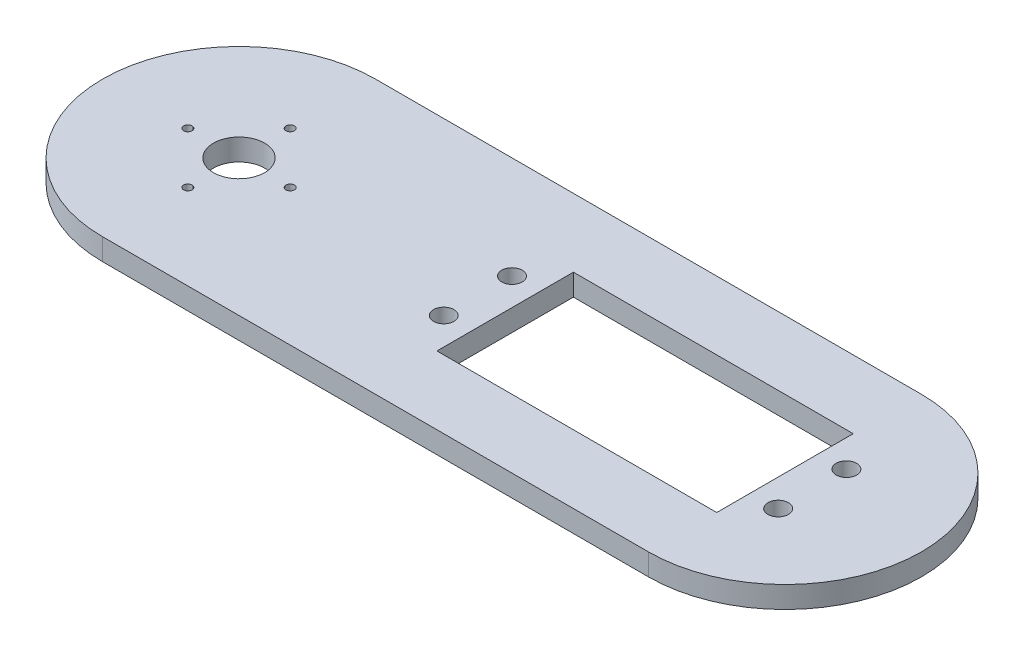
from build123d import *

# Parameters (mm, degrees)
SKETCH3_R           = 3.75
SKETCH3_R_2         = 0.625
SKETCH3_R_3         = 1.5
SKETCH3_W           = 41
SKETCH3_H           = 20
BOSS_EXTRUDE1_DEPTH = 3.175


with BuildPart() as part:
    # Sketch3 → Boss-Extrude1 (new body)
    with BuildSketch(Plane(origin=(0, 0, 0), x_dir=(1, 0, 0), z_dir=(0, 1, 0))):
        with BuildLine():
            Line((-40.372263643, 20), (39.627736357, 20))
            ThreePointArc((39.627736357, 20), (59.627736357, 0), (39.627736357, -20))
            Line((39.627736357, -20), (-40.372263643, -20))
            ThreePointArc((-40.372263643, -20), (-60.372263643, 0), (-40.372263643, 20))
        make_face()
        with Locations((-40.372263643, 0)):
            Circle(SKETCH3_R, mode=Mode.SUBTRACT)
        with Locations((-32.872263643, 0)):
            Circle(SKETCH3_R_2, mode=Mode.SUBTRACT)
        with Locations((-5.372263643, 5)):
            Circle(SKETCH3_R_3, mode=Mode.SUBTRACT)
        with Locations((-5.372263643, -5)):
            Circle(SKETCH3_R_3, mode=Mode.SUBTRACT)
        with Locations((43.627736357, 5)):
            Circle(SKETCH3_R_3, mode=Mode.SUBTRACT)
        with Locations((43.627736357, -5)):
            Circle(SKETCH3_R_3, mode=Mode.SUBTRACT)
        with Locations((-47.872263643, 0)):
            Circle(SKETCH3_R_2, mode=Mode.SUBTRACT)
        with Locations((-40.372263643, 7.5)):
            Circle(SKETCH3_R_2, mode=Mode.SUBTRACT)
        with Locations((-40.372263643, -7.5)):
            Circle(SKETCH3_R_2, mode=Mode.SUBTRACT)
        with Locations((19.127736357, 0)):
            Rectangle(SKETCH3_W, SKETCH3_H, mode=Mode.SUBTRACT)
    extrude(amount=BOSS_EXTRUDE1_DEPTH)


solid = part.part
